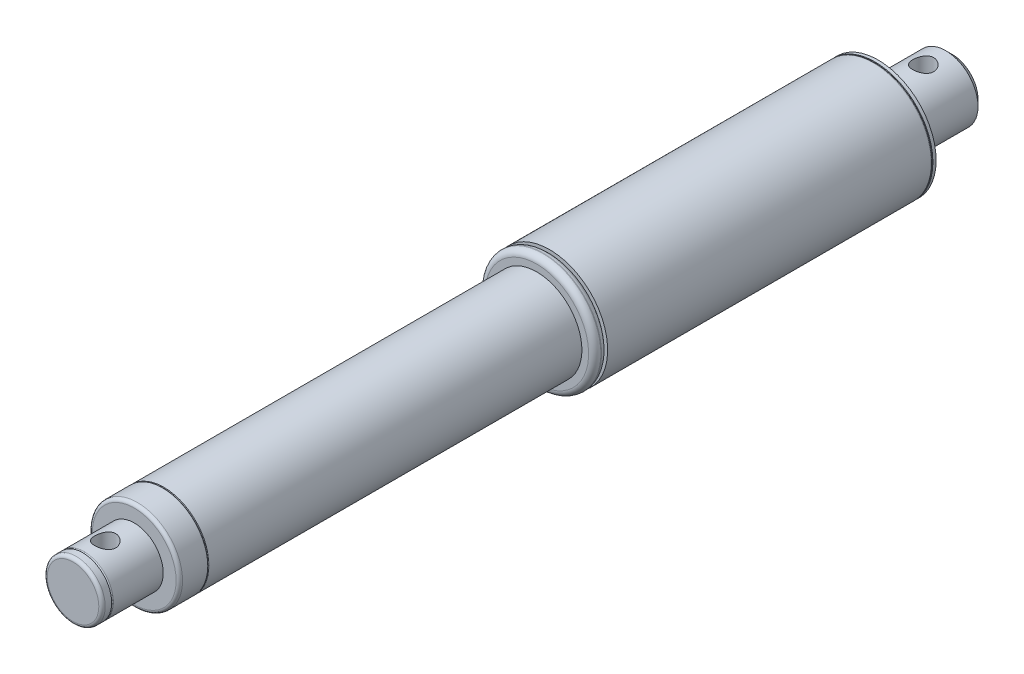
from build123d import *

# Parameters (mm, degrees)
SKETCH_1_R               = 14
EXTRUDE_1_DEPTH          = 116
SKETCH_2_R               = 18
EXTRUDE_2_DEPTH          = 4
FILLET_1_R               = 1.9
FILLET_2_R               = 0.2
SKETCH_3_R               = 14
EXTRUDE_3_DEPTH          = 9
FILLET_4_R               = 0.2
FILLET_5_R               = 1
SKETCH_4_R               = 18
EXTRUDE_4_DEPTH          = 101
FILLET_6_R               = 0.5
SKETCH_6_R               = 9
EXTRUDE_5_DEPTH          = 16
FILLET_7_R               = 0.5
SKETCH_7_R               = 9
EXTRUDE_6_DEPTH          = 3
FILLET_8_R               = 1
CUT_EXTRUDE_1_DEPTH      = 147.232691308
CUT_EXTRUDE_1_DEPTH_BACK = 147.232691308
SKETCH_8_R               = 3.25


with BuildPart() as part:
    # Эскиз1 → Бобышка-Вытянуть1 (new body)
    with BuildSketch(Plane.XY):
        with Locations(Location((0, 0, 0), (0, 0, 180))):
            Circle(SKETCH_1_R)
    extrude(amount=EXTRUDE_1_DEPTH)

    # Эскиз2 → Бобышка-Вытянуть2 (add)
    with BuildSketch(Plane(origin=(0, 0, 0), x_dir=(-1, 0, 0), z_dir=(0, 0, -1))):
        Circle(SKETCH_2_R)
    extrude(amount=EXTRUDE_2_DEPTH)

    # Скругление1
    fillet_1_edges = [part.edges().sort_by_distance(p)[0] for p in [
        (18, 0, 0),
        (18, 0, -4),
    ]]
    fillet(fillet_1_edges, radius=FILLET_1_R)

    # Скругление2
    fillet_2_edges = [part.edges().sort_by_distance(p)[0] for p in [
        (14, 0, 116),
    ]]
    fillet(fillet_2_edges, radius=FILLET_2_R)

    # Эскиз3 → Бобышка-Вытянуть3 (add)
    with BuildSketch(Plane.XY.offset(116)):
        with Locations(Location((0, 0, 0), (0, 0, 180))):
            Circle(SKETCH_3_R)
    extrude(amount=EXTRUDE_3_DEPTH)

    # Скругление4
    fillet_4_edges = [part.edges().sort_by_distance(p)[0] for p in [
        (14, 0, 116),
    ]]
    fillet(fillet_4_edges, radius=FILLET_4_R - 0.0001)  # a hair under: the kernel refuses the full size

    # Скругление5
    fillet_5_edges = [part.edges().sort_by_distance(p)[0] for p in [
        (14, 0, 125),
    ]]
    fillet(fillet_5_edges, radius=FILLET_5_R)

    # Эскиз4 → Бобышка-Вытянуть4 (add)
    with BuildSketch(Plane(origin=(0, 0, -4), x_dir=(-1, 0, 0), z_dir=(0, 0, -1))):
        Circle(SKETCH_4_R)
    extrude(amount=EXTRUDE_4_DEPTH)

    # Скругление6
    fillet_6_edges = [part.edges().sort_by_distance(p)[0] for p in [
        (18, 0, -105),
    ]]
    fillet(fillet_6_edges, radius=FILLET_6_R)

    # Эскиз5 → Повернуть1 (revolve)
    with BuildSketch(Plane(origin=(0, 0, 0), x_dir=(0, 0, -1), z_dir=(1, 0, 0)), mode=Mode.PRIVATE) as revolve_1_sk:
        with BuildLine():
            Line((105, 0), (129, 0))
            Line((129, 0), (129, 8))
            Line((129, 8), (127, 10))
            Line((127, 10), (110, 10))
            ThreePointArc((110, 10), (108.375970462, 14.187985231), (106, 18))
            Line((106, 18), (105, 18))
            Line((105, 18), (105, 0))
        make_face()
    revolve(revolve_1_sk.sketch.rotate(Axis((0, 0, -105), (0, 0, -1)), 90), axis=Axis((0, 0, -105), (0, 0, -1)))

    # Эскиз6 → Бобышка-Вытянуть5 (add)
    with BuildSketch(Plane.XY.offset(125)):
        Circle(SKETCH_6_R)
    extrude(amount=EXTRUDE_5_DEPTH)

    # Скругление7
    fillet_7_edges = [part.edges().sort_by_distance(p)[0] for p in [
        (-9, 0, 141),
    ]]
    fillet(fillet_7_edges, radius=FILLET_7_R)

    # Эскиз7 → Бобышка-Вытянуть6 (add)
    with BuildSketch(Plane.XY.offset(141)):
        Circle(SKETCH_7_R)
    extrude(amount=EXTRUDE_6_DEPTH)

    # Скругление8
    fillet_8_edges = [part.edges().sort_by_distance(p)[0] for p in [
        (-9, 0, 144),
    ]]
    fillet(fillet_8_edges, radius=FILLET_8_R)

    # Эскиз8 → Вырез-Вытянуть1 (cut, two sides: drawn at the far end of the back side and taken through both)
    with BuildSketch(Plane(origin=(0, 0, 0), x_dir=(1, 0, 0), z_dir=(0, 1, 0)).offset(-CUT_EXTRUDE_1_DEPTH_BACK)):
        with Locations(Location((0, -134, 0), (0, 0, 270))):
            Circle(SKETCH_8_R)
        with Locations(Location((0, 120, 0), (0, 0, 270))):
            Circle(SKETCH_8_R)
    extrude(amount=CUT_EXTRUDE_1_DEPTH + CUT_EXTRUDE_1_DEPTH_BACK, mode=Mode.SUBTRACT)


solid = part.part
